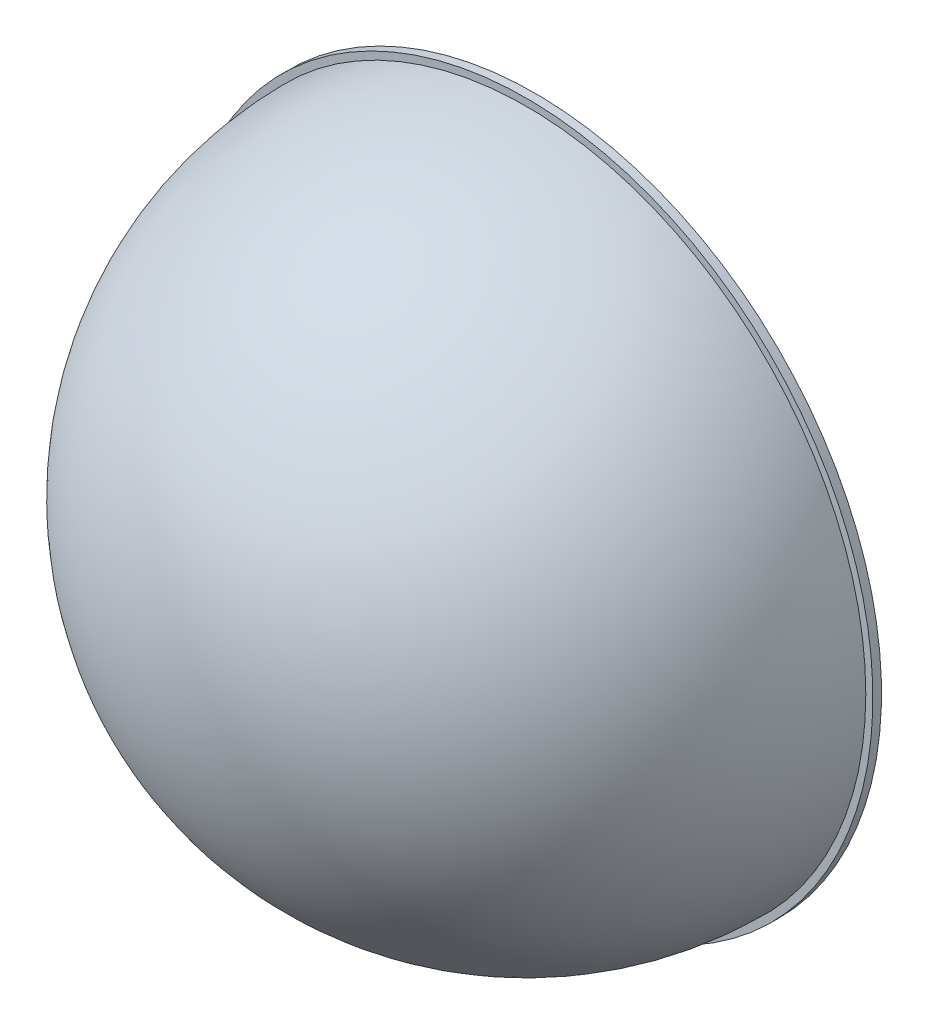
from build123d import *

# Parameters (mm, degrees)
SHELL1_T            = -2
SKETCH2_R           = 80.5
SKETCH2_R_2         = 76.85
BOSS_EXTRUDE1_DEPTH = 2


# Read off the part's stored shape, not the designer's step: Revolve1
with BuildPart() as part:
    # Revolve1 outline → Revolve1 (revolve)
    with BuildSketch(Plane.XZ):
        with BuildLine():
            Line((0, 0), (78.85, -7.9e-08))
            ThreePointArc((78.85, -7.9e-08), (55.755369724, 55.755369669), (0, 78.85))
            Line((0, 78.85), (0, 0))
        make_face()
    revolve(axis=Axis((0, 0, 0), (0, 0, 1)))

    # Shell1
    shell1_openings = [part.faces().sort_by_distance(p)[0] for p in [
        (0, 0, 0),
    ]]
    offset(amount=SHELL1_T, openings=shell1_openings, kind=Kind.INTERSECTION)

    # Sketch2 → Boss-Extrude1 (add)
    with BuildSketch(Plane(origin=(0, 0, 0), x_dir=(-1, 0, 0), z_dir=(0, 0, -1))):
        Circle(SKETCH2_R)
        Circle(SKETCH2_R_2, mode=Mode.SUBTRACT)
    extrude(amount=BOSS_EXTRUDE1_DEPTH)


solid = part.part
